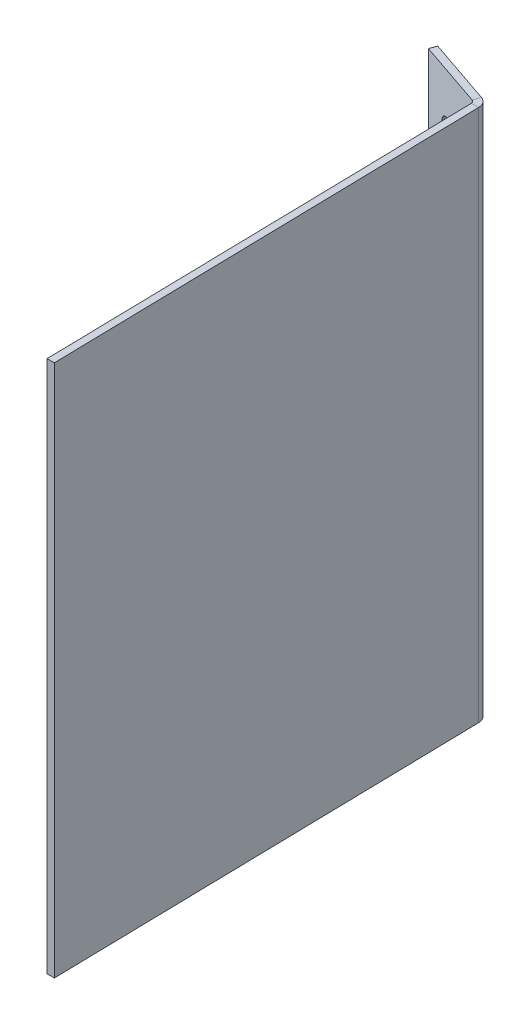
from build123d import *

# Parameters (mm, degrees)
BASE_FLANGE1_DEPTH          = 110
F_3_0MM_PRESS_DOWEL_HOLE1_D = 3


# Sheet-metal steps are written as plain solids
with BuildPart() as part:
    # Sketch1 → Base-Flange1 (new body)
    with BuildSketch(Plane(origin=(0, 0, 0), x_dir=(1, 0, 0), z_dir=(0, 1, 0))):
        with BuildLine():
            Line((0, 0), (-1.855570085, 89.464986247))
            ThreePointArc((-1.855570085, 89.464986247), (-1.99751505, 89.884629471), (-2.354487023, 90.146964789))
            Line((-2.354487023, 90.146964789), (-16.065007208, 94.817561297))
            Line((-16.065007208, 94.817561297), (-15.5813159, 96.237435489))
            Line((-15.5813159, 96.237435489), (-1.870795715, 91.56683898))
            ThreePointArc((-1.870795715, 91.56683898), (-0.786891948, 90.770288381), (-0.355892615, 89.496090669))
            Line((-0.355892615, 89.496090669), (1.49967747, 0.031104422))
            Line((1.49967747, 0.031104422), (0, 0))
        make_face()
    extrude(amount=BASE_FLANGE1_DEPTH)

    # Ø3.0mm Press Dowel Hole1 (through all)
    with Locations(Plane(origin=(27.754960473, 0, -81.474592183), x_dir=(-0.9465827940969574, 0, -0.32246087192029516), z_dir=(0.32246087192029516, 0, -0.9465827940969574))):
        with Locations((39.781812899, 10), (39.781812899, 100)):
            Hole(F_3_0MM_PRESS_DOWEL_HOLE1_D / 2)


solid = part.part
